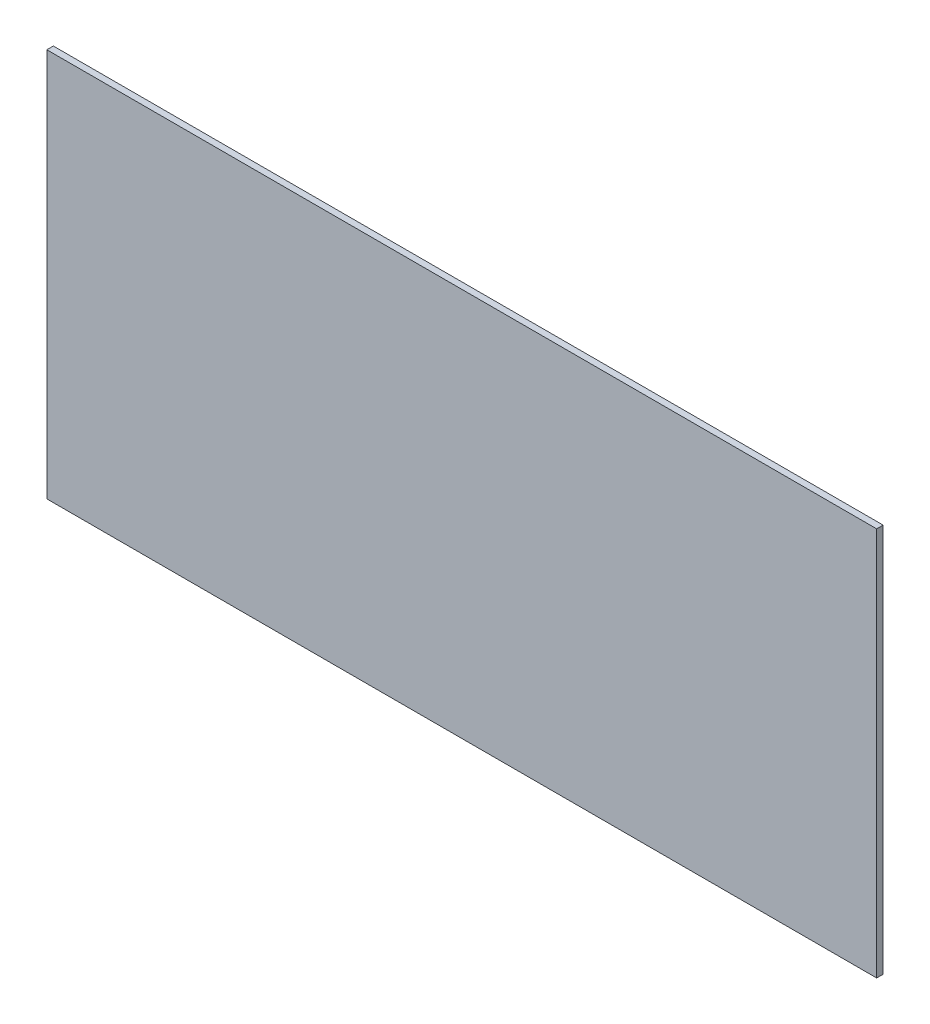
from build123d import *

# Parameters (mm, degrees)
SKETCH1_W           = 406.4
SKETCH1_H           = 190.5
BOSS_EXTRUDE1_DEPTH = 3.175


with BuildPart() as part:
    # Sketch1 → Boss-Extrude1 (new body)
    with BuildSketch(Plane.XY):
        with Locations((203.2, 95.25)):
            Rectangle(SKETCH1_W, SKETCH1_H)
    extrude(amount=BOSS_EXTRUDE1_DEPTH)


solid = part.part
